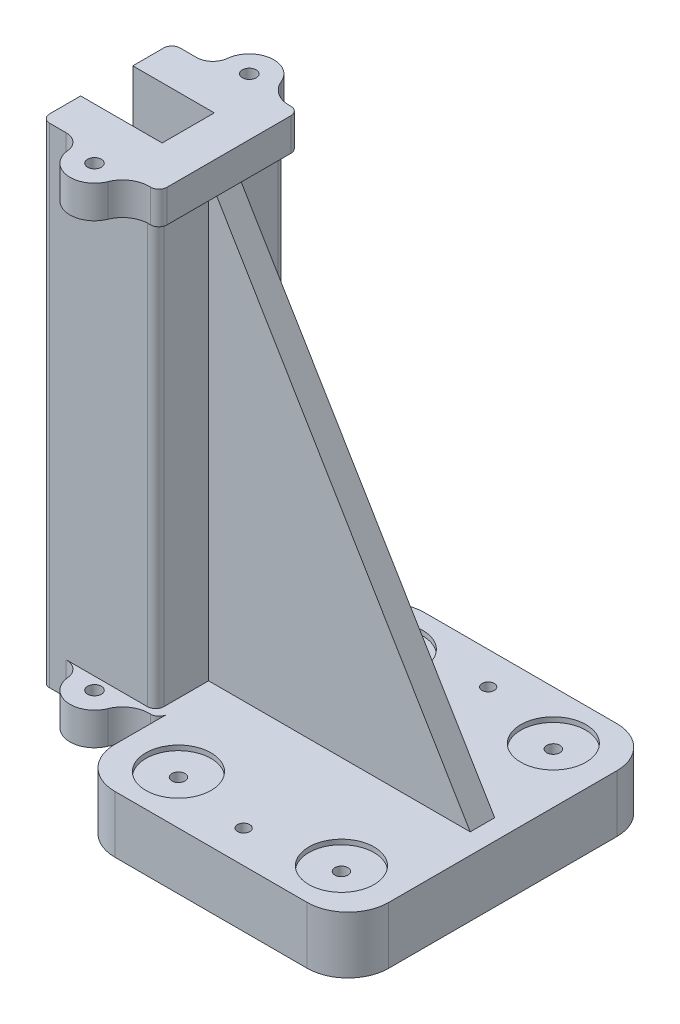
from build123d import *
from build123d.topology import SkipClean

# Parameters (mm, degrees)
SKETCH_2_W          = 168
SKETCH_2_H          = 190
EXTRUDE_1_DEPTH     = 35
CUT_EXTRUDE_1_REACH = 133.552
SKETCH_3_R          = 3.75
CUT_EXTRUDE_2_REACH = 133.552
SKETCH_4_R          = 4
SKETCH_5_R          = 20
CUT_EXTRUDE_3_DEPTH = 3
FILLET_1_R          = 25
EXTRUDE_2_DEPTH     = 300
CUT_EXTRUDE_START   = 260
CUT_EXTRUDE_4_DEPTH = 260
EXTRUDE_3_DEPTH     = 7.5
SKETCH_12_R         = 4.25
CUT_EXTRUDE_5_DEPTH = 366.418937659


with BuildPart() as part:
    # 草图2 → 凸台-拉伸1 (new body)
    with BuildSketch(Plane(origin=(0, 0, 0), x_dir=(1, 0, 0), z_dir=(0, 1, 0))):
        Rectangle(SKETCH_2_W, SKETCH_2_H)
    extrude(amount=EXTRUDE_1_DEPTH)

    # 草图3 → 切除-拉伸1 (cut, up to next)
    with BuildSketch(Plane(origin=(0, 35, 0), x_dir=(1, 0, 0), z_dir=(0, 1, 0)), mode=Mode.PRIVATE) as cut_extrude_1_sk1:
        with Locations((0, 75)):
            Circle(SKETCH_3_R)
    cut_extrude_1_tool1 = extrude(cut_extrude_1_sk1.sketch, amount=-CUT_EXTRUDE_1_REACH, mode=Mode.PRIVATE) & part.part
    # 草图3 → 切除-拉伸1 (cut, up to next)
    with BuildSketch(Plane(origin=(0, 35, 0), x_dir=(1, 0, 0), z_dir=(0, 1, 0)), mode=Mode.PRIVATE) as cut_extrude_1_sk2:
        with Locations((0, -75)):
            Circle(SKETCH_3_R)
    cut_extrude_1_tool2 = extrude(cut_extrude_1_sk2.sketch, amount=-CUT_EXTRUDE_1_REACH, mode=Mode.PRIVATE) & part.part
    add(cut_extrude_1_tool1.solids().sort_by_distance((0, 35, -75))[0], mode=Mode.SUBTRACT)
    add(cut_extrude_1_tool2.solids().sort_by_distance((0, 35, 75))[0], mode=Mode.SUBTRACT)

    # 草图4 → 切除-拉伸2 (cut, up to next)
    with BuildSketch(Plane(origin=(0, 35, 0), x_dir=(1, 0, 0), z_dir=(0, 1, 0)), mode=Mode.PRIVATE) as cut_extrude_2_sk1:
        with Locations((-50, 65)):
            Circle(SKETCH_4_R)
    cut_extrude_2_tool1 = extrude(cut_extrude_2_sk1.sketch, amount=-CUT_EXTRUDE_2_REACH, mode=Mode.PRIVATE) & part.part
    # 草图4 → 切除-拉伸2 (cut, up to next)
    with BuildSketch(Plane(origin=(0, 35, 0), x_dir=(1, 0, 0), z_dir=(0, 1, 0)), mode=Mode.PRIVATE) as cut_extrude_2_sk2:
        with Locations((50, 65)):
            Circle(SKETCH_4_R)
    cut_extrude_2_tool2 = extrude(cut_extrude_2_sk2.sketch, amount=-CUT_EXTRUDE_2_REACH, mode=Mode.PRIVATE) & part.part
    # 草图4 → 切除-拉伸2 (cut, up to next)
    with BuildSketch(Plane(origin=(0, 35, 0), x_dir=(1, 0, 0), z_dir=(0, 1, 0)), mode=Mode.PRIVATE) as cut_extrude_2_sk3:
        with Locations((-50, -65)):
            Circle(SKETCH_4_R)
    cut_extrude_2_tool3 = extrude(cut_extrude_2_sk3.sketch, amount=-CUT_EXTRUDE_2_REACH, mode=Mode.PRIVATE) & part.part
    # 草图4 → 切除-拉伸2 (cut, up to next)
    with BuildSketch(Plane(origin=(0, 35, 0), x_dir=(1, 0, 0), z_dir=(0, 1, 0)), mode=Mode.PRIVATE) as cut_extrude_2_sk4:
        with Locations((50, -65)):
            Circle(SKETCH_4_R)
    cut_extrude_2_tool4 = extrude(cut_extrude_2_sk4.sketch, amount=-CUT_EXTRUDE_2_REACH, mode=Mode.PRIVATE) & part.part
    add(cut_extrude_2_tool1.solids().sort_by_distance((-50, 35, -65))[0], mode=Mode.SUBTRACT)
    add(cut_extrude_2_tool2.solids().sort_by_distance((50, 35, -65))[0], mode=Mode.SUBTRACT)
    add(cut_extrude_2_tool3.solids().sort_by_distance((-50, 35, 65))[0], mode=Mode.SUBTRACT)
    add(cut_extrude_2_tool4.solids().sort_by_distance((50, 35, 65))[0], mode=Mode.SUBTRACT)

    # 草图5 → 切除-拉伸3 (cut)
    with BuildSketch(Plane(origin=(0, 35, 0), x_dir=(1, 0, 0), z_dir=(0, 1, 0))):
        with Locations((-50, 65)):
            Circle(SKETCH_5_R)
        with Locations((50, 65)):
            Circle(SKETCH_5_R)
        with Locations((50, -65)):
            Circle(SKETCH_5_R)
        with Locations((-50, -65)):
            Circle(SKETCH_5_R)
    extrude(amount=-CUT_EXTRUDE_3_DEPTH, mode=Mode.SUBTRACT)

    # 圆角1
    fillet_1_edges = [part.edges().sort_by_distance(p)[0] for p in [
        (-84, 17.5, -95),
        (84, 17.5, -95),
        (84, 17.5, 95),
        (-84, 17.5, 95),
    ]]
    fillet(fillet_1_edges, radius=FILLET_1_R)

    # 草图8 → 凸台-拉伸2 (add)
    with BuildSketch(Plane(origin=(0, 315, 0), x_dir=(1, 0, 0), z_dir=(0, 1, 0))):
        with BuildLine():
            Line((-109, 16), (-109, -16))
            Line((-109, -16), (-159, -16))
            Line((-159, -16), (-159, -35))
            ThreePointArc((-159, -35), (-157.535533906, -38.535533906), (-154, -40))
            Line((-154, -40), (-143.874685928, -40))
            ThreePointArc((-143.874685928, -40), (-137.166481995, -42.583801513), (-133.924811557, -49))
            ThreePointArc((-133.924811557, -49), (-121.126812284, -62.348456806), (-105.096341116, -53.129233486))
            ThreePointArc((-105.096341116, -53.129233486), (-98.786961451, -45.541087589), (-89.248249261, -43.01102837))
            ThreePointArc((-89.248249261, -43.01102837), (-85.553352811, -41.639435016), (-84, -38.017194942))
            Line((-84, -38.017194942), (-84, 38.017194942))
            ThreePointArc((-84, 38.017194942), (-85.553352811, 41.639435016), (-89.248249261, 43.01102837))
            ThreePointArc((-89.248249261, 43.01102837), (-98.786961451, 45.541087589), (-105.096341116, 53.129233486))
            ThreePointArc((-105.096341116, 53.129233486), (-121.126812284, 62.348456806), (-133.924811557, 49))
            ThreePointArc((-133.924811557, 49), (-137.166481995, 42.583801513), (-143.874685928, 40))
            Line((-143.874685928, 40), (-154, 40))
            ThreePointArc((-154, 40), (-157.535533906, 38.535533906), (-159, 35))
            Line((-159, 35), (-159, 16))
            Line((-159, 16), (-109, 16))
        make_face()
    extrude(amount=-EXTRUDE_2_DEPTH)

    # 草图10 → 切除-拉伸4 (cut)
    with SkipClean():  # the faces are left unmerged after this step: merging them gives an invalid solid
        with BuildSketch(Plane(origin=(0, 35, 0), x_dir=(1, 0, 0), z_dir=(0, 1, 0)).offset(CUT_EXTRUDE_START)):
            with BuildLine():
                ThreePointArc((-94, 40), (-90.464466094, 38.535533906), (-89, 35))
                Line((-89, 35), (-89, -35))
                ThreePointArc((-89, -35), (-90.464466094, -38.535533906), (-94, -40))
                Line((-94, -40), (-154, -40))
                ThreePointArc((-154, -40), (-157.535533906, -38.535533906), (-159, -35))
                Line((-159, -35), (-159, -16))
                Line((-159, -16), (-166.391829747, -16))
                Line((-166.391829747, -16), (-166.391829747, -67.593352797))
                Line((-166.391829747, -67.593352797), (-78.896973025, -67.593352797))
                Line((-78.896973025, -67.593352797), (-78.896973025, 67.593352797))
                Line((-78.896973025, 67.593352797), (-166.391829747, 67.593352797))
                Line((-166.391829747, 67.593352797), (-166.391829747, 16))
                Line((-166.391829747, 16), (-159, 16))
                Line((-159, 16), (-159, 35))
                ThreePointArc((-159, 35), (-157.535533906, 38.535533906), (-154, 40))
                Line((-154, 40), (-94, 40))
            make_face()
        extrude(amount=-CUT_EXTRUDE_4_DEPTH, mode=Mode.SUBTRACT)
    add(part.part.scale(1), mode=Mode.REPLACE)  # the faces are merged on a copy

    # 草图11 → 凸台-拉伸3 (add, symmetric)
    with BuildSketch(Plane.XY):
        Polygon((-84, 295), (71.5, 35), (-89.248249261, 35), (-89.248249261, 295), align=None)
    extrude(amount=EXTRUDE_3_DEPTH, both=True)

    # 草图12 → 切除-拉伸5 (cut, through all)
    with BuildSketch(Plane(origin=(0, 315, 0), x_dir=(1, 0, 0), z_dir=(0, 1, 0))):
        with Locations((-119, 47.5)):
            Circle(SKETCH_12_R)
        with Locations((-119, -47.5)):
            Circle(SKETCH_12_R)
    extrude(amount=-CUT_EXTRUDE_5_DEPTH, mode=Mode.SUBTRACT)


solid = part.part
